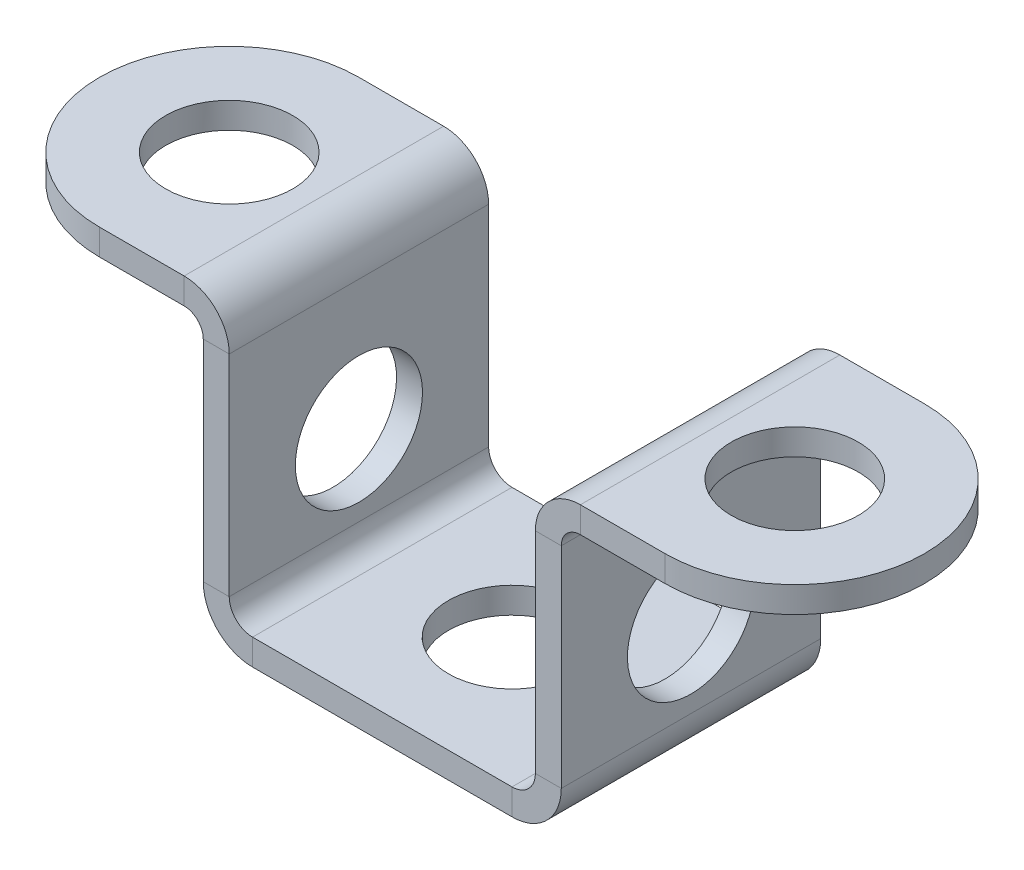
from build123d import *

# Parameters (mm, degrees)
SKETCH1_W               = 10
SKETCH1_H               = 10
SKETCH1_R               = 2.45
BASE_FLANGE1_DEPTH      = 1
EDGE_FLANGE1_DEPTH      = 10
EDGE_FLANGE1_BEND_DEPTH = 10
SKETCH12_R              = 2.45
CUT_EXTRUDE1_DEPTH      = 18.760630619
EDGE_FLANGE2_DEPTH      = 10
EDGE_FLANGE2_BEND_DEPTH = 10
SKETCH19_R              = 2.45
CUT_EXTRUDE2_DEPTH      = 21.385234351
CUT_EXTRUDE3_DEPTH      = 21.385234351


# Sheet-metal steps are written as plain solids
with BuildPart() as part:
    # Sketch1 → Base-Flange1 (new body)
    with BuildSketch(Plane(origin=(0, 0, 0), x_dir=(1, 0, 0), z_dir=(0, 1, 0))):
        Rectangle(SKETCH1_W, SKETCH1_H)
        with Locations(Location((0, 0, 0), (0, 0, 270))):
            Circle(SKETCH1_R, mode=Mode.SUBTRACT)
    extrude(amount=BASE_FLANGE1_DEPTH)

    # Edge-Flange1 section (across the edge) → Edge-Flange1 (add)
    with BuildSketch(Plane(origin=(-5.9, 1, -5), x_dir=(1, 0, 0), z_dir=(0, 0, 1))):
        with BuildLine():
            Line((-1, 0.9), (-1, 9))
            Line((-1, 9), (0, 9))
            Line((0, 9), (0, 0.9))
            ThreePointArc((0, 0.9), (0.263603897, 0.263603897), (0.9, 0))
            Line((0.9, 0), (0.9, -1))
            ThreePointArc((0.9, -1), (-0.443502884, -0.443502884), (-1, 0.9))
        make_face()
    extrude(amount=EDGE_FLANGE1_DEPTH)

    # Edge-Flange1 section 2 (across the edge) → Edge-Flange1 bend (add)
    with BuildSketch(Plane(origin=(5.9, 1, 5), x_dir=(-1, 0, 0), z_dir=(0, 0, -1))):
        with BuildLine():
            Line((-1, 0.9), (-1, 9))
            Line((-1, 9), (0, 9))
            Line((0, 9), (0, 0.9))
            ThreePointArc((0, 0.9), (0.263603897, 0.263603897), (0.9, 0))
            Line((0.9, 0), (0.9, -1))
            ThreePointArc((0.9, -1), (-0.443502884, -0.443502884), (-1, 0.9))
        make_face()
    extrude(amount=EDGE_FLANGE1_BEND_DEPTH)

    # Sketch12 → Cut-Extrude1 (cut, through all)
    with BuildSketch(Plane(origin=(6.9, 0, 0), x_dir=(0, 0, -1), z_dir=(1, 0, 0))):
        with Locations(Location((0, 5, 0), (0, 0, 90))):
            Circle(SKETCH12_R)
    extrude(amount=-CUT_EXTRUDE1_DEPTH, mode=Mode.SUBTRACT)

    # Edge-Flange2 section (across the edge) → Edge-Flange2 (add)
    with BuildSketch(Plane(origin=(6.9, 10.7366, -5), x_dir=(0, -1, 0), z_dir=(0, 0, 1))):
        with BuildLine():
            Line((-1, 0.7366), (-1, 9))
            Line((-1, 9), (0, 9))
            Line((0, 9), (0, 0.7366))
            ThreePointArc((0, 0.7366), (0.215745145, 0.215745145), (0.7366, 0))
            Line((0.7366, 0), (0.7366, -1))
            ThreePointArc((0.7366, -1), (-0.491361636, -0.491361636), (-1, 0.7366))
        make_face()
    extrude(amount=EDGE_FLANGE2_DEPTH)

    # Edge-Flange2 section 2 (across the edge) → Edge-Flange2 bend (add)
    with BuildSketch(Plane(origin=(-6.9, 10.7366, 5), x_dir=(0, -1, 0), z_dir=(0, 0, -1))):
        with BuildLine():
            Line((-1, 0.7366), (-1, 9))
            Line((-1, 9), (0, 9))
            Line((0, 9), (0, 0.7366))
            ThreePointArc((0, 0.7366), (0.215745145, 0.215745145), (0.7366, 0))
            Line((0.7366, 0), (0.7366, -1))
            ThreePointArc((0.7366, -1), (-0.491361636, -0.491361636), (-1, 0.7366))
        make_face()
    extrude(amount=EDGE_FLANGE2_BEND_DEPTH)

    # Sketch19 → Cut-Extrude2 (cut, through all)
    with BuildSketch(Plane(origin=(0, 11.7366, 0), x_dir=(1, 0, 0), z_dir=(0, 1, 0))):
        with Locations(Location((-10.9, 0, 0), (0, 0, 270))):
            Circle(SKETCH19_R)
        with Locations(Location((10.9, 0, 0), (0, 0, 270))):
            Circle(SKETCH19_R)
    extrude(amount=-CUT_EXTRUDE2_DEPTH, mode=Mode.SUBTRACT)

    # Sketch20 → Cut-Extrude3 (cut, through all)
    with BuildSketch(Plane(origin=(0, 11.7366, 0), x_dir=(1, 0, 0), z_dir=(0, 1, 0))):
        with BuildLine():
            Line((15.9, -5), (15.9, -3.1e-08))
            ThreePointArc((15.9, -3.1e-08), (14.435533895, -3.535533917), (10.9, -5))
            Line((10.9, -5), (15.9, -5))
        make_face()
        with BuildLine():
            Line((15.9, 5), (10.9, 5))
            ThreePointArc((10.9, 5), (14.435533917, 3.535533895), (15.9, -3.1e-08))
            Line((15.9, -3.1e-08), (15.9, 5))
        make_face()
        with BuildLine():
            ThreePointArc((-10.9, -5), (-14.435533906, -3.535533906), (-15.9, 0))
            Line((-15.9, 0), (-15.9, -5))
            Line((-15.9, -5), (-10.9, -5))
        make_face()
        with BuildLine():
            ThreePointArc((-15.9, 0), (-14.435533906, 3.535533906), (-10.9, 5))
            Line((-10.9, 5), (-15.9, 5))
            Line((-15.9, 5), (-15.9, 0))
        make_face()
    extrude(amount=-CUT_EXTRUDE3_DEPTH, mode=Mode.SUBTRACT)


solid = part.part
